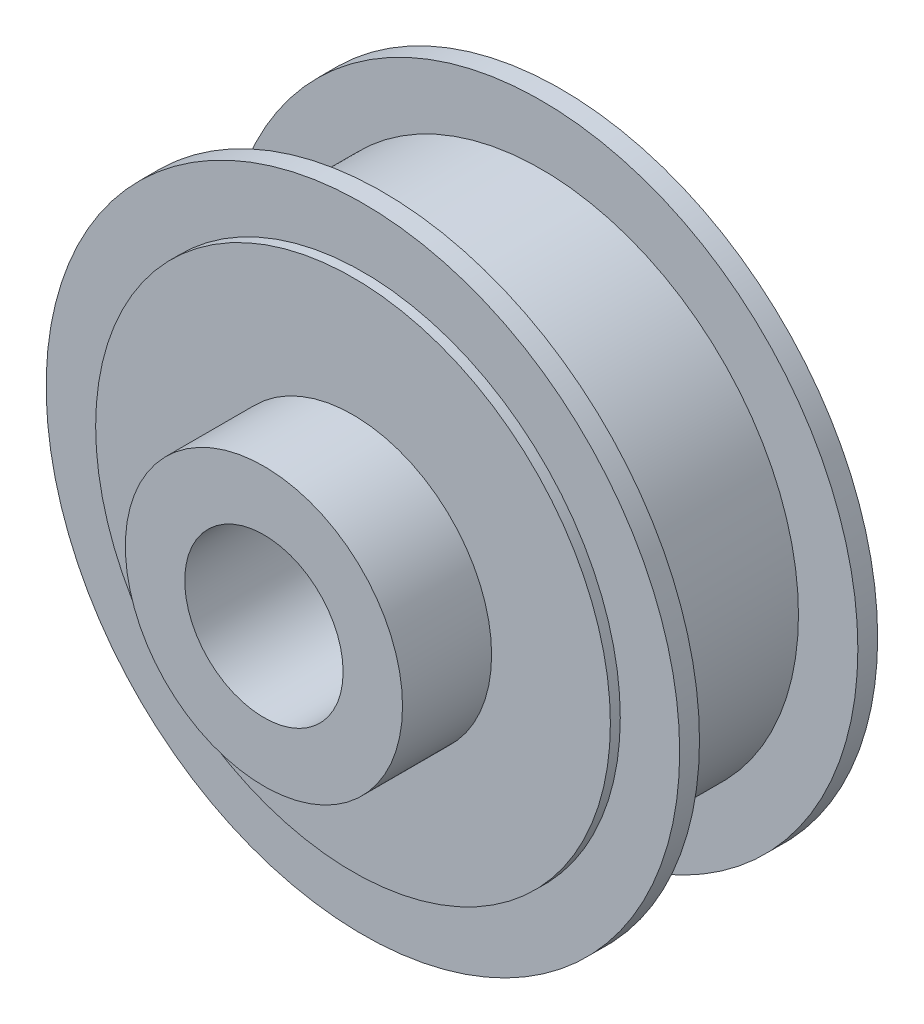
from build123d import *

# Parameters (mm, degrees)
ESQUISSE1_R             = 16
BOSS_EXTRU_1_DEPTH      = 1
ESQUISSE2_R             = 13
BOSS_EXTRU_2_DEPTH      = 8
ESQUISSE3_R             = 16
BOSS_EXTRU_3_DEPTH      = 1
ESQUISSE4_R             = 7
BOSS_EXTRU_4_DEPTH      = 5
ESQUISSE6_R             = 13
BOSS_EXTRU_5_DEPTH      = 0.5
BOSS_EXTRU_6_START      = 0.5
ESQUISSE7_R             = 13
BOSS_EXTRU_6_DEPTH      = 0.5
ESQUISSE8_R             = 4
ENL_V_MAT_EXTRU_2_DEPTH = 16


with BuildPart() as part:
    # Esquisse1 → Boss.-Extru.1 (new body)
    with BuildSketch(Plane.XY):
        Circle(ESQUISSE1_R)
    extrude(amount=BOSS_EXTRU_1_DEPTH)

    # Esquisse2 → Boss.-Extru.2 (add)
    with BuildSketch(Plane.XY.offset(1)):
        Circle(ESQUISSE2_R)
    extrude(amount=BOSS_EXTRU_2_DEPTH)

    # Esquisse3 → Boss.-Extru.3 (add)
    with BuildSketch(Plane.XY.offset(9)):
        Circle(ESQUISSE3_R)
    extrude(amount=BOSS_EXTRU_3_DEPTH)

    # Esquisse4 → Boss.-Extru.4 (add)
    with BuildSketch(Plane.XY.offset(10)):
        Circle(ESQUISSE4_R)
    extrude(amount=BOSS_EXTRU_4_DEPTH)

    # Esquisse6 → Boss.-Extru.5 (add)
    with BuildSketch(Plane.XY.offset(10)):
        Circle(ESQUISSE6_R)
    extrude(amount=BOSS_EXTRU_5_DEPTH)

    # Esquisse7 → Boss.-Extru.6 (add)
    with BuildSketch(Plane(origin=(0, 0, 0), x_dir=(-1, 0, 0), z_dir=(0, 0, -1)).offset(BOSS_EXTRU_6_START)):
        Circle(ESQUISSE7_R)
    extrude(amount=-BOSS_EXTRU_6_DEPTH)

    # Esquisse8 → Enlèv. mat.-Extru.2 (cut)
    with BuildSketch(Plane.XY.offset(15)):
        Circle(ESQUISSE8_R)
    extrude(amount=-ENL_V_MAT_EXTRU_2_DEPTH, mode=Mode.SUBTRACT)


solid = part.part
